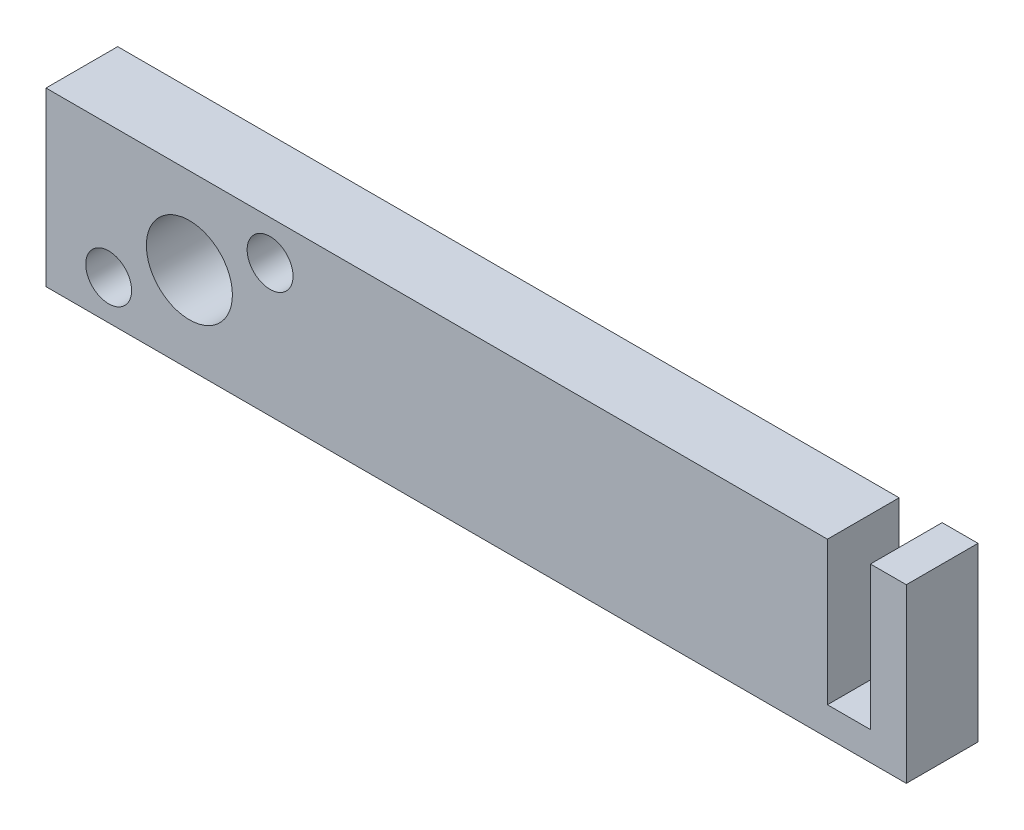
from build123d import *

# Parameters (mm, degrees)
EXTRUDE_1_DEPTH = 5


with BuildPart() as part:
    # ｽｹｯﾁ1 → ﾎﾞｽ - 押し出し1 (new body)
    with BuildSketch(Plane.XY):
        Polygon((-10, -6), (0, -6), (50, -6), (50, 6), (47.5, 6), (47.5, -4), (44.5, -4), (44.5, 6), (-10, 6), align=None)
        with BuildLine():
            ThreePointArc((-4.029165125, -3.25), (-7.174646447, -3.664110472), (-4.243524479, -2.45))
            ThreePointArc((-4.243524479, -2.45), (-4.083683803, -2.835889528), (-4.029165125, -3.25))
        make_face(mode=Mode.SUBTRACT)
        with BuildLine():
            ThreePointArc((2.598076211, 1.5), (2.897777479, 0.776457135), (3, 0))
            ThreePointArc((3, 0), (2.121320344, -2.121320344), (0, -3))
            ThreePointArc((0, -3), (-1.5, -2.598076211), (-2.598076211, -1.5))
            ThreePointArc((-2.598076211, -1.5), (-1.5, 2.598076211), (2.598076211, 1.5))
        make_face(mode=Mode.SUBTRACT)
        with BuildLine():
            ThreePointArc((7.229165125, 3.25), (6.043275597, 1.704518678), (4.243524479, 2.45))
            ThreePointArc((4.243524479, 2.45), (5.215054652, 4.795481322), (7.229165125, 3.25))
        make_face(mode=Mode.SUBTRACT)
    extrude(amount=EXTRUDE_1_DEPTH)


solid = part.part
